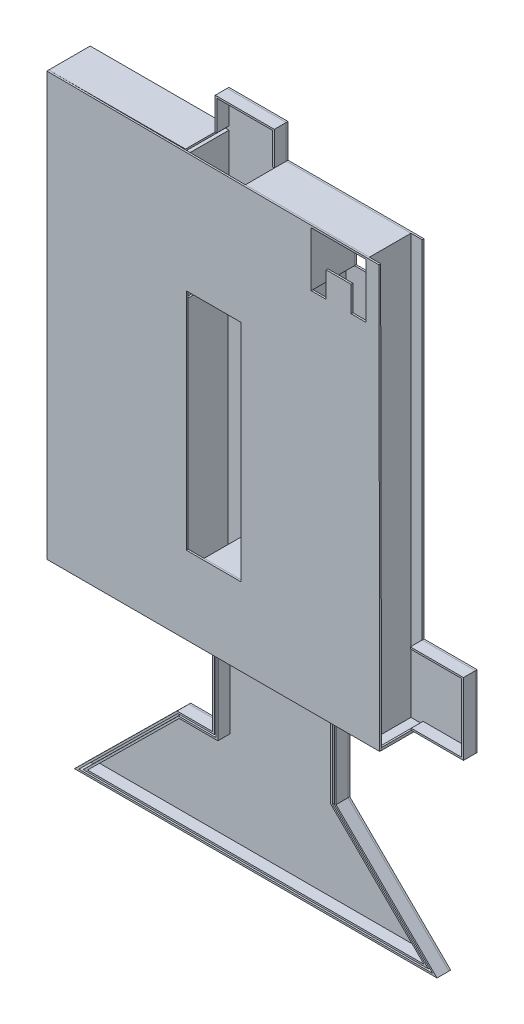
from build123d import *

# Parameters (mm, degrees)
PAREDES_OUTLINE_W          = 9925
PAREDES_OUTLINE_H          = 4830
PAREDES_OUTLINE_W_2        = 3725
PAREDES_OUTLINE_H_2        = 4530
PAREDES_OUTLINE_W_3        = 5750
PAREDES_OUTLINE_W_4        = 4750
PAREDES_OUTLINE_H_3        = 2850
PAREDES_OUTLINE_H_4        = 5056.933945735
PAREDES_OUTLINE_H_5        = 14361.727815226
PAREDES_OUTLINE_H_6        = 3288.272184774
PAREDES_OUTLINE_H_7        = 850
PAREDES_OUTLINE_H_8        = 1600
PAREDES_OUTLINE_H_9        = 150
PAREDES_OUTLINE_W_5        = 1800
PAREDES_OUTLINE_H_10       = 450
PAREDES_OUTLINE_W_6        = 1500
PAREDES_DEPTH              = 3500
CROQUIS2_W                 = 150
CROQUIS2_H                 = 3075
PAREDES_2_DEPTH            = 3500
CROQUIS2_W_2               = 5050
CROQUIS2_H_2               = 6123.837612125
CROQUIS2_W_3               = 4750
CROQUIS2_H_3               = 2850
PAREDES_2_2_DEPTH          = 3500
PAREDES_2_3_DEPTH          = 3500
CROQUIS2_H_4               = 2920
CROQUIS2_H_5               = 2620
PAREDES_2_4_DEPTH          = 3500
PAREDES_2_5_DEPTH          = 3500
CROQUIS2_W_4               = 575
CROQUIS2_H_6               = 6550
PAREDES_2_6_DEPTH          = 3500
PISO_DEPTH                 = 150
BARANDALES_DEPTH           = 1000
BARANDALES_2_DEPTH         = 1000
CROQUIS7_W                 = 40408.624153155
CROQUIS7_H                 = 18247.019344159
BARANDAL_TERRAZA_DEPTH     = 2500
CORTAR_EXTRUIR6_DEPTH      = 69240.079307858
CORTAR_EXTRUIR6_DEPTH_BACK = 69240.079307858
CROQUIS8_W                 = 4600
CROQUIS8_H                 = 18914.855807165
SALIENTE_EXTRUIR3_DEPTH    = 150


# Read off the part's stored shape, not the designer's step: Paredes
with BuildPart() as part:
    # Paredes outline → Paredes (new body)
    # profile 1 of 5: a face of its own
    with BuildSketch(Plane.XY):
        with Locations((16414.682926172, 47280.474136006)):
            Rectangle(PAREDES_OUTLINE_W, PAREDES_OUTLINE_H)
        with Locations((13464.682926172, 47280.474136006)):
            Rectangle(PAREDES_OUTLINE_W_2, PAREDES_OUTLINE_H_2, mode=Mode.SUBTRACT)
        with Locations((18352.182926172, 47280.474136006)):
            Rectangle(PAREDES_OUTLINE_W_3, PAREDES_OUTLINE_H_2, mode=Mode.SUBTRACT)
    # profile 2 of 5: a face of its own
    with BuildSketch(Plane.XY):
        Polygon((21877.182926172, 40819.416394283), (21727.182926172, 40819.416394283), (21727.182926172, 41265.474136006), (21577.182926172, 41265.474136006), (21577.182926172, 40819.416394283), (21212.790005461, 40819.416394283), (21212.790005461, 41415.474136006), (16827.182926172, 41415.474136006), (16827.182926172, 25265.474136006), (21877.182926172, 25265.474136006), align=None)
        with Locations((19352.182926172, 26840.474136006)):
            Rectangle(PAREDES_OUTLINE_W_4, PAREDES_OUTLINE_H_3, mode=Mode.SUBTRACT)
        with Locations((19352.182926172, 29840.474136006)):
            Rectangle(PAREDES_OUTLINE_W_4, PAREDES_OUTLINE_H_3, mode=Mode.SUBTRACT)
        with Locations((19352.182926172, 32840.474136006)):
            Rectangle(PAREDES_OUTLINE_W_4, PAREDES_OUTLINE_H_3, mode=Mode.SUBTRACT)
        with Locations((19352.182926172, 35840.474136006)):
            Rectangle(PAREDES_OUTLINE_W_4, PAREDES_OUTLINE_H_3, mode=Mode.SUBTRACT)
        with Locations((19352.182926172, 38840.474136006)):
            Rectangle(PAREDES_OUTLINE_W_4, PAREDES_OUTLINE_H_3, mode=Mode.SUBTRACT)
        Polygon((21727.182926172, 40669.416394283), (21727.182926172, 40415.474136006), (16977.182926172, 40415.474136006), (16977.182926172, 41265.474136006), (21062.790005461, 41265.474136006), (21062.790005461, 40669.416394283), align=None, mode=Mode.SUBTRACT)
    # profile 3 of 5: a face of its own
    with BuildSketch(Plane.XY):
        Polygon((15477.182926172, 41415.474136006), (10427.182926172, 41415.474136006), (10427.182926172, 51565.474136006), (21802.182926172, 51565.474136006), (21802.182926172, 51715.474136006), (10277.182926172, 51715.474136006), (10277.182926172, 16115.474136006), (21577.182926172, 16115.474136006), (21577.182926172, 7885.474136006), (18585.423513472, 7885.474136006), (9953.952781914, -634.525863994), (40475.99626335, -634.525863994), (31977.182926172, 7754.529939441), (31977.182926172, 16115.474136006), (38302.182926172, 16115.474136006), (38302.182926172, 16340.474136006), (38152.182926172, 16340.474136006), (38152.182926172, 16265.474136006), (37277.182926172, 16265.474136006), (37277.182926172, 51565.474136025), (26777.182926172, 51565.474136025), (26777.182926172, 47785.474136006), (26927.182926172, 47785.474136006), (26927.182926172, 48635.474136006), (31677.182926172, 48635.474136006), (31677.182926172, 48785.474136006), (26927.182926172, 48785.474136006), (26927.182926172, 51415.474136025), (32377.182926172, 51415.474136025), (32377.182926172, 46825.474136025), (32527.182926172, 46825.474136025), (32527.182926172, 51415.474136025), (37127.182926172, 51415.474136025), (37127.182926172, 41415.474136006), (32227.182926172, 41415.474136006), (32227.182926172, 22308.540190271), (37127.182926172, 22308.540190271), (37127.182926172, 16415.474136006), (33327.182926172, 16415.474136006), (33327.182926172, 19340.474136006), (33177.182926172, 19340.474136006), (33177.182926172, 16415.474136006), (31827.182926172, 16415.474136006), (31827.182926172, 19340.474136006), (31677.182926172, 19340.474136006), (31677.182926172, 16415.474136006), (23627.182926172, 16415.474136006), (23627.182926172, 22315.474136006), (23477.182926172, 22315.474136006), (23477.182926172, 22465.474136006), (26777.182926172, 22465.474136006), (26777.182926172, 22315.474136006), (31977.182926172, 22315.474136006), (31977.182926172, 41565.474136006), (26627.182926172, 41565.474136006), (26627.182926172, 22615.474136006), (23327.182926172, 22615.474136006), (23327.182926172, 16115.474136006), (31527.182926172, 16115.474136006), (31527.182926172, 7566.418332572), (39379.535974834, -184.525863994), (11050.413070431, -184.525863994), (18770.108724711, 7435.474136006), (22027.182926172, 7435.474136006), (22027.182926172, 16340.474136006), (21877.182926172, 16340.474136006), (21877.182926172, 7585.474136006), (18708.546987632, 7585.474136006), (10684.926307592, -334.525863994), (39745.022737672, -334.525863994), (31677.182926172, 7629.122201528), (31677.182926172, 16265.474136006), (31827.182926172, 16265.474136006), (31827.182926172, 7691.826070485), (40110.509500511, -484.525863994), (10319.439544753, -484.525863994), (18646.985250552, 7735.474136006), (21727.182926172, 7735.474136006), (21727.182926172, 16265.474136006), (10427.182926172, 16265.474136006), (10427.182926172, 19265.474136006), (15477.182926172, 19265.474136006), (15477.182926172, 37415.474136006), (10427.182926172, 37415.474136006), (10427.182926172, 41312.84559098), (11219.603976384, 40383.255199957), (11527.182926172, 40383.255199958), (11527.182926172, 40265.474136006), (15477.182926172, 40265.474136006), align=None)
        with Locations((12952.182926172, 20840.474136006)):
            Rectangle(PAREDES_OUTLINE_W_4, PAREDES_OUTLINE_H_3, mode=Mode.SUBTRACT)
        with Locations((12952.182926172, 23840.474136006)):
            Rectangle(PAREDES_OUTLINE_W_4, PAREDES_OUTLINE_H_3, mode=Mode.SUBTRACT)
        with Locations((34752.182926172, 24987.007163138)):
            Rectangle(PAREDES_OUTLINE_W_4, PAREDES_OUTLINE_H_4, mode=Mode.SUBTRACT)
        with Locations((12952.182926172, 26840.474136006)):
            Rectangle(PAREDES_OUTLINE_W_4, PAREDES_OUTLINE_H_3, mode=Mode.SUBTRACT)
        with Locations((12952.182926172, 29840.474136006)):
            Rectangle(PAREDES_OUTLINE_W_4, PAREDES_OUTLINE_H_3, mode=Mode.SUBTRACT)
        with Locations((12952.182926172, 32840.474136006)):
            Rectangle(PAREDES_OUTLINE_W_4, PAREDES_OUTLINE_H_3, mode=Mode.SUBTRACT)
        with Locations((12952.182926172, 35840.474136006)):
            Rectangle(PAREDES_OUTLINE_W_4, PAREDES_OUTLINE_H_3, mode=Mode.SUBTRACT)
        Polygon((15327.182926172, 40415.474136006), (11677.182926172, 40415.474136006), (11677.182926172, 40533.255199958), (11288.841226548, 40533.255199958), (10664.667715405, 41265.474136006), (15327.182926172, 41265.474136006), align=None, mode=Mode.SUBTRACT)
        with Locations((29302.182926172, 29646.338043619)):
            Rectangle(PAREDES_OUTLINE_W_4, PAREDES_OUTLINE_H_5, mode=Mode.SUBTRACT)
        with Locations((29302.182926172, 38621.338043619)):
            Rectangle(PAREDES_OUTLINE_W_4, PAREDES_OUTLINE_H_6, mode=Mode.SUBTRACT)
        with Locations((34752.182926172, 29090.474136006)):
            Rectangle(PAREDES_OUTLINE_W_4, PAREDES_OUTLINE_H_3, mode=Mode.SUBTRACT)
        with Locations((34752.182926172, 32090.474136006)):
            Rectangle(PAREDES_OUTLINE_W_4, PAREDES_OUTLINE_H_3, mode=Mode.SUBTRACT)
        with Locations((34752.182926172, 35090.474136006)):
            Rectangle(PAREDES_OUTLINE_W_4, PAREDES_OUTLINE_H_3, mode=Mode.SUBTRACT)
        with Locations((34752.182926172, 38090.474136006)):
            Rectangle(PAREDES_OUTLINE_W_4, PAREDES_OUTLINE_H_3, mode=Mode.SUBTRACT)
        with Locations((29302.182926172, 40840.474136006)):
            Rectangle(PAREDES_OUTLINE_W_4, PAREDES_OUTLINE_H_7, mode=Mode.SUBTRACT)
        with Locations((34752.182926172, 40465.474136006)):
            Rectangle(PAREDES_OUTLINE_W_4, PAREDES_OUTLINE_H_8, mode=Mode.SUBTRACT)
    # profile 4 of 5: a face of its own
    with BuildSketch(Plane.XY):
        with Locations((29302.182926172, 47710.474136006)):
            Rectangle(PAREDES_OUTLINE_W_4, PAREDES_OUTLINE_H_9)
    # profile 5 of 5: a face of its own
    with BuildSketch(Plane.XY):
        with Locations((32502.182926172, 20453.034554945)):
            Rectangle(PAREDES_OUTLINE_W_5, PAREDES_OUTLINE_H_10)
        with Locations((32502.182926172, 20453.034554945)):
            Rectangle(PAREDES_OUTLINE_W_6, PAREDES_OUTLINE_H_9, mode=Mode.SUBTRACT)
    extrude(amount=PAREDES_DEPTH)

    # Croquis7 → Barandal terraza (cut)
    with BuildSketch(Plane.XY.offset(3500)):
        with Locations((24031.558101974, 6928.825988688)):
            Rectangle(CROQUIS7_W, CROQUIS7_H)
    extrude(amount=-BARANDAL_TERRAZA_DEPTH, mode=Mode.SUBTRACT)



with BuildPart() as body_2:
    # Croquis2 → Paredes 2 (new body)
    with BuildSketch(Plane.XY):
        with Locations((16152.182926172, 17802.974136006)):
            Rectangle(CROQUIS2_W, CROQUIS2_H)
    extrude(amount=PAREDES_2_DEPTH)


with BuildPart() as body_3:
    # Croquis2 → Paredes 2 2 (new body)
    with BuildSketch(Plane.XY):
        with Locations((19352.182926172, 22327.392942069)):
            Rectangle(CROQUIS2_W_2, CROQUIS2_H_2)
        with Locations((19352.182926172, 23840.474136006)):
            Rectangle(CROQUIS2_W_3, CROQUIS2_H_3, mode=Mode.SUBTRACT)
        with Locations((19352.182926172, 20840.474136006)):
            Rectangle(CROQUIS2_W_3, CROQUIS2_H_3, mode=Mode.SUBTRACT)
    extrude(amount=PAREDES_2_2_DEPTH)


with BuildPart() as body_4:
    # Croquis2 → Paredes 2 3 (new body)
    with BuildSketch(Plane.XY):
        Polygon((11452.182926172, 51415.474136006), (11452.182926172, 51565.474136006), (10427.182926172, 51565.474136006), (10427.182926172, 44865.474136006), (11452.182926172, 44865.474136006), (11452.182926172, 45015.474136006), (10652.182926172, 45015.474136006), (10652.182926172, 51415.474136006), align=None)
    extrude(amount=PAREDES_2_3_DEPTH)


with BuildPart() as body_5:
    # Croquis2 → Paredes 2 4 (new body)
    with BuildSketch(Plane.XY):
        with Locations((29302.182926172, 46325.474136006)):
            Rectangle(CROQUIS2_W_2, CROQUIS2_H_4)
        with Locations((29302.182926172, 46325.474136006)):
            Rectangle(CROQUIS2_W_3, CROQUIS2_H_5, mode=Mode.SUBTRACT)
    extrude(amount=PAREDES_2_4_DEPTH)


with BuildPart() as body_6:
    # Croquis2 → Paredes 2 5 (new body)
    with BuildSketch(Plane.XY):
        with Locations((15402.182926172, 38840.474136006)):
            Rectangle(CROQUIS2_W, CROQUIS2_H_3)
    extrude(amount=PAREDES_2_5_DEPTH)


with BuildPart() as body_7:
    # Croquis2 → Paredes 2 6 (new body)
    with BuildSketch(Plane.XY):
        with Locations((21664.682926172, 48140.474136006)):
            Rectangle(CROQUIS2_W_4, CROQUIS2_H_6)
    extrude(amount=PAREDES_2_6_DEPTH)


with BuildPart() as body_8:
    # Croquis3 → Piso (new body)
    with BuildSketch(Plane(origin=(0, 0, 0), x_dir=(-1, 0, 0), z_dir=(0, 0, -1))):
        Polygon((-9953.952781914, -634.525863994), (-40475.99626335, -634.525863994), (-31977.182926172, 7754.529939441), (-31977.182926172, 7885.474136006), (-31977.182926172, 16115.474136006), (-38227.182926172, 16115.474136006), (-38227.182926172, 16340.474136006), (-42702.182926172, 16340.474136006), (-42702.182926172, 22383.540190271), (-38227.182926172, 22383.540190271), (-38227.182926172, 51565.474136025), (-26777.182926172, 51565.474136025), (-26777.182926172, 54390.474136006), (-21802.182926172, 54390.474136006), (-21802.182926172, 51565.474136025), (-10277.182926172, 51565.474136025), (-10277.182926172, 16115.474136006), (-21577.182926172, 16115.474136006), (-21577.182926172, 7885.474136006), (-18585.423513472, 7885.474136006), align=None)
    extrude(amount=PISO_DEPTH)

    # Croquis12 → Cortar-Extruir6 (cut, two sides: drawn at the far end of the back side and taken through both)
    with BuildSketch(Plane.XY.offset(-CORTAR_EXTRUIR6_DEPTH_BACK)):
        Polygon((37127.182926172, 46825.474136025), (35887.182926172, 46825.474136025), (35887.182926172, 48975.474136025), (33787.182926172, 48975.474136025), (33787.182926172, 46825.474136025), (32527.182926172, 46825.474136025), (32527.182926172, 51415.474136025), (37127.182926172, 51415.474136025), align=None)
    extrude(amount=CORTAR_EXTRUIR6_DEPTH + CORTAR_EXTRUIR6_DEPTH_BACK, mode=Mode.SUBTRACT)


with BuildPart() as body_9:
    # Croquis5 → Barandales (new body)
    with BuildSketch(Plane.XY):
        Polygon((21802.182926172, 51727.637490556), (21802.182926172, 54390.474136006), (26777.182926172, 54390.474136006), (26777.182926172, 51565.474136025), (26627.182926172, 51565.474136025), (26627.182926172, 54240.474136006), (21952.182926172, 54240.474136006), (21952.182926172, 51727.637490556), align=None)
    extrude(amount=BARANDALES_DEPTH)


with BuildPart() as body_10:
    # Croquis5 → Barandales 2 (new body)
    with BuildSketch(Plane.XY):
        Polygon((38227.182926172, 22383.540190271), (42702.182926172, 22383.540190271), (42702.182926172, 16340.474136006), (38302.182926172, 16340.474136006), (38302.182926172, 16490.474136006), (42552.182926172, 16490.474136006), (42552.182926172, 22233.540190271), (38227.182926172, 22233.540190271), align=None)
    extrude(amount=BARANDALES_2_DEPTH)


with BuildPart() as part_1:
    add(part.part)

    add(body_2.part)  # Saliente-Extruir3 merges body 2

    add(body_3.part)  # Saliente-Extruir3 merges body 3

    add(body_4.part)  # Saliente-Extruir3 merges body 4

    add(body_5.part)  # Saliente-Extruir3 merges body 5

    add(body_6.part)  # Saliente-Extruir3 merges body 6

    add(body_7.part)  # Saliente-Extruir3 merges body 7
    # Croquis8 → Saliente-Extruir3 (add)
    # profile 1 of 2: a face of its own
    with BuildSketch(Plane.XY.offset(3500)):
        Polygon((38227.182926172, 51565.474136025), (10277.182926172, 51715.474136006), (10277.182926172, 16115.474136006), (38302.182926172, 16115.474136006), align=None)
        with Locations((24327.182926172, 32108.046232424)):
            Rectangle(CROQUIS8_W, CROQUIS8_H, mode=Mode.SUBTRACT)
        Polygon((37127.182926172, 51415.474136025), (37127.182926172, 46825.474136025), (35887.182926172, 46825.474136025), (35687.182926172, 46825.474136025), (35687.182926172, 48765.474136025), (33977.182926172, 48765.474136025), (33977.182926172, 46825.474136025), (33787.182926172, 46825.474136025), (32527.182926172, 46825.474136025), (32527.182926172, 51415.474136025), align=None, mode=Mode.SUBTRACT)
    # profile 2 of 2: a face of its own
    with BuildSketch(Plane.XY.offset(3500)):
        Polygon((33977.182926172, 46825.474136025), (33787.182926172, 46825.474136025), (33787.182926172, 48975.474136025), (35887.182926172, 48975.474136025), (35887.182926172, 46825.474136025), (35687.182926172, 46825.474136025), (35687.182926172, 48765.474136025), (33977.182926172, 48765.474136025), align=None)
    extrude(amount=SALIENTE_EXTRUIR3_DEPTH)


solid = Compound([body_8.part, body_9.part, body_10.part, part_1.part])
